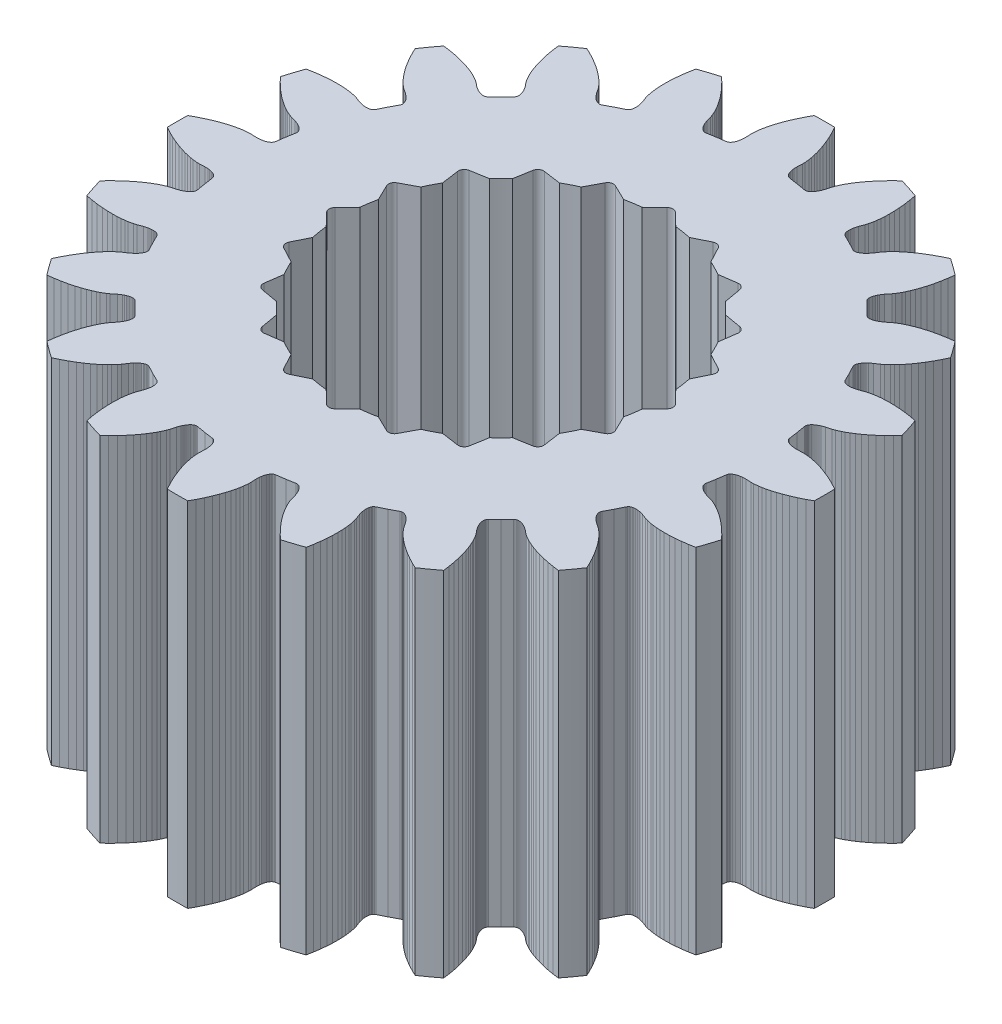
from build123d import *

# Parameters (mm, degrees)
SKETCH2_R           = 1
BOSS_EXTRUDE1_DEPTH = 6
CUT_EXTRUDE1_DEPTH  = 6


with BuildPart() as part:
    # Sketch2 → Boss-Extrude1 (new body)
    with BuildSketch(Plane(origin=(0, 0, 0), x_dir=(1, 0, 0), z_dir=(0, 1, 0))):
        with BuildLine():
            Line((0.437953894, 4.732665816), (0.430042291, 4.808517351))
            Line((0.430042291, 4.808517351), (0.421963885, 4.857362483))
            Line((0.421963885, 4.857362483), (0.41003729, 4.914704159))
            Line((0.41003729, 4.914704159), (0.393495471, 4.980238734))
            Line((0.393495471, 4.980238734), (0.372280186, 5.051616285))
            Line((0.372280186, 5.051616285), (0.344894894, 5.13134186))
            Line((0.344894894, 5.13134186), (0.311848301, 5.215851943))
            Line((0.311848301, 5.215851943), (0.271243793, 5.308129962))
            Line((0.271243793, 5.308129962), (0.223490897, 5.405326852))
            Line((0.223490897, 5.405326852), (0.17362484, 5.497251118))
            ThreePointArc((0.17362484, 5.497251118), (-1.14e-07, 5.499992315), (-0.173625068, 5.497251115))
            Line((-0.173625068, 5.497251115), (-0.223491109, 5.40532684))
            Line((-0.223491109, 5.40532684), (-0.271244004, 5.30812995))
            Line((-0.271244004, 5.30812995), (-0.311848512, 5.21585193))
            Line((-0.311848512, 5.21585193), (-0.344895106, 5.131341847))
            Line((-0.344895106, 5.131341847), (-0.372280397, 5.051616273))
            Line((-0.372280397, 5.051616273), (-0.393495683, 4.980238722))
            Line((-0.393495683, 4.980238722), (-0.410037502, 4.914704146))
            Line((-0.410037502, 4.914704146), (-0.421964096, 4.85736247))
            Line((-0.421964096, 4.85736247), (-0.430042502, 4.808517338))
            Line((-0.430042502, 4.808517338), (-0.437954105, 4.732665803))
            Line((-0.437954105, 4.732665803), (-0.438848904, 4.686153156))
            Line((-0.438848904, 4.686153156), (-0.434136903, 4.598359437))
            Line((-0.434136903, 4.598359437), (-0.437125701, 4.538474584))
            Line((-0.437125701, 4.538474584), (-0.440687596, 4.511677521))
            Line((-0.440687596, 4.511677521), (-0.445532499, 4.487036208))
            Line((-0.445532499, 4.487036208), (-0.451554927, 4.464587701))
            Line((-0.451554927, 4.464587701), (-0.458670633, 4.444375686))
            Line((-0.458670633, 4.444375686), (-0.466784119, 4.426435617))
            Line((-0.466784119, 4.426435617), (-0.475807889, 4.410791368))
            Line((-0.475807889, 4.410791368), (-0.48564799, 4.397488267))
            Line((-0.48564799, 4.397488267), (-0.496213866, 4.386530492))
            Line((-0.496213866, 4.386530492), (-0.507400065, 4.377954992))
            Line((-0.507400065, 4.377954992), (-0.519117739, 4.371775853))
            Line((-0.519117739, 4.371775853), (-0.537475389, 4.367055966))
            Line((-0.537475389, 4.367055966), (-0.688311733, 4.34582866))
            Line((-0.688311733, 4.34582866), (-0.838325226, 4.319406079))
            Line((-0.838325226, 4.319406079), (-0.857242917, 4.318222179))
            Line((-0.857242917, 4.318222179), (-0.870296551, 4.320477903))
            Line((-0.870296551, 4.320477903), (-0.883585254, 4.325176904))
            Line((-0.883585254, 4.325176904), (-0.897020134, 4.33233334))
            Line((-0.897020134, 4.33233334), (-0.910489504, 4.34194459))
            Line((-0.910489504, 4.34194459), (-0.923905962, 4.354034652))
            Line((-0.923905962, 4.354034652), (-0.937166102, 4.368589495))
            Line((-0.937166102, 4.368589495), (-0.95017946, 4.385613341))
            Line((-0.95017946, 4.385613341), (-0.962844102, 4.405102105))
            Line((-0.962844102, 4.405102105), (-0.975066503, 4.427040207))
            Line((-0.975066503, 4.427040207), (-0.986734698, 4.451425098))
            Line((-0.986734698, 4.451425098), (-1.008082602, 4.507455407))
            Line((-1.008082602, 4.507455407), (-1.030730994, 4.592408279))
            Line((-1.030730994, 4.592408279), (-1.045955299, 4.636367892))
            Line((-1.045955299, 4.636367892), (-1.07691909, 4.70606217))
            Line((-1.07691909, 4.70606217), (-1.099696095, 4.750020282))
            Line((-1.099696095, 4.750020282), (-1.12875848, 4.800869955))
            Line((-1.12875848, 4.800869955), (-1.164742018, 4.858085315))
            Line((-1.164742018, 4.858085315), (-1.206975822, 4.919413521))
            Line((-1.206975822, 4.919413521), (-1.257657395, 4.986774486))
            Line((-1.257657395, 4.986774486), (-1.31520161, 5.056936404))
            Line((-1.31520161, 5.056936404), (-1.382334201, 5.132150593))
            Line((-1.382334201, 5.132150593), (-1.457785437, 5.209833831))
            Line((-1.457785437, 5.209833831), (-1.533617059, 5.281849521))
            ThreePointArc((-1.533617059, 5.281849521), (-1.699591229, 5.230803506), (-1.863871246, 5.174543425))
            Line((-1.863871246, 5.174543425), (-1.882890455, 5.07170878))
            Line((-1.882890455, 5.07170878), (-1.898270752, 4.9645126))
            Line((-1.898270752, 4.9645126), (-1.908372352, 4.864203495))
            Line((-1.908372352, 4.864203495), (-1.913686454, 4.773617669))
            Line((-1.913686454, 4.773617669), (-1.915094954, 4.689331624))
            Line((-1.915094954, 4.689331624), (-1.913214955, 4.614891656))
            Line((-1.913214955, 4.614891656), (-1.908695856, 4.547452868))
            Line((-1.908695856, 4.547452868), (-1.902319157, 4.489232175))
            Line((-1.902319157, 4.489232175), (-1.894908249, 4.440281322))
            Line((-1.894908249, 4.440281322), (-1.878993244, 4.3656974))
            Line((-1.878993244, 4.3656974), (-1.865471055, 4.321184734))
            Line((-1.865471055, 4.321184734), (-1.833859951, 4.239144024))
            Line((-1.833859951, 4.239144024), (-1.818196964, 4.181266572))
            Line((-1.818196964, 4.181266572), (-1.813303763, 4.154680368))
            Line((-1.813303763, 4.154680368), (-1.810296958, 4.129747928))
            Line((-1.810296958, 4.129747928), (-1.809087656, 4.106537098))
            Line((-1.809087656, 4.106537098), (-1.809609255, 4.085115455))
            Line((-1.809609255, 4.085115455), (-1.811781858, 4.065546231))
            Line((-1.811781858, 4.065546231), (-1.815529649, 4.04787917))
            Line((-1.815529649, 4.04787917), (-1.820777268, 4.032186415))
            Line((-1.820777268, 4.032186415), (-1.827439869, 4.018499914))
            Line((-1.827439869, 4.018499914), (-1.835428652, 4.006887438))
            Line((-1.835428652, 4.006887438), (-1.844663343, 3.997389747))
            Line((-1.844663343, 3.997389747), (-1.860663971, 3.987228029))
            Line((-1.860663971, 3.987228029), (-1.997558247, 3.920428641))
            Line((-1.997558247, 3.920428641), (-2.13206453, 3.84894255))
            Line((-2.13206453, 3.84894255), (-2.149690451, 3.841970642))
            Line((-2.149690451, 3.841970642), (-2.162802262, 3.84008224))
            Line((-2.162802262, 3.84008224), (-2.176892641, 3.84044484))
            Line((-2.176892641, 3.84044484), (-2.191881443, 3.84309934))
            Line((-2.191881443, 3.84309934), (-2.207661612, 3.84807793))
            Line((-2.207661612, 3.84807793), (-2.224157456, 3.85543035))
            Line((-2.224157456, 3.85543035), (-2.241266294, 3.865175215))
            Line((-2.241266294, 3.865175215), (-2.258903356, 3.877344557))
            Line((-2.258903356, 3.877344557), (-2.276970538, 3.891965843))
            Line((-2.276970538, 3.891965843), (-2.295373933, 3.909053338))
            Line((-2.295373933, 3.909053338), (-2.314006432, 3.928639037))
            Line((-2.314006432, 3.928639037), (-2.351623838, 3.975330144))
            Line((-2.351623838, 3.975330144), (-2.399415607, 4.049126396))
            Line((-2.399415607, 4.049126396), (-2.427479025, 4.086229921))
            Line((-2.427479025, 4.086229921), (-2.478464069, 4.14294477))
            Line((-2.478464069, 4.14294477), (-2.513710064, 4.177712965))
            Line((-2.513710064, 4.177712965), (-2.557063476, 4.217093076))
            Line((-2.557063476, 4.217093076), (-2.608966333, 4.260388639))
            Line((-2.608966333, 4.260388639), (-2.668084542, 4.305664246))
            Line((-2.668084542, 4.305664246), (-2.737101265, 4.354066862))
            Line((-2.737101265, 4.354066862), (-2.813510242, 4.403012748))
            Line((-2.813510242, 4.403012748), (-2.90059962, 4.453800535))
            Line((-2.90059962, 4.453800535), (-2.996363458, 4.504365955))
            Line((-2.996363458, 4.504365955), (-3.090737653, 4.549423759))
            ThreePointArc((-3.090737653, 4.549423759), (-3.232814409, 4.44958726), (-3.371668693, 4.345315411))
            Line((-3.371668693, 4.345315411), (-3.357979391, 4.241636592))
            Line((-3.357979391, 4.241636592), (-3.339481491, 4.134934192))
            Line((-3.339481491, 4.134934192), (-3.318091491, 4.036412992))
            Line((-3.318091491, 4.036412992), (-3.295152991, 3.948618592))
            Line((-3.295152991, 3.948618592), (-3.270446591, 3.868022592))
            Line((-3.270446591, 3.868022592), (-3.245655491, 3.797806892))
            Line((-3.245655491, 3.797806892), (-3.220517791, 3.735065292))
            Line((-3.220517791, 3.735065292), (-3.196462091, 3.681664592))
            Line((-3.196462091, 3.681664592), (-3.174287191, 3.637399692))
            Line((-3.174287191, 3.637399692), (-3.136103391, 3.571384192))
            Line((-3.136103391, 3.571384192), (-3.109487891, 3.533228692))
            Line((-3.109487891, 3.533228692), (-3.054071991, 3.464971692))
            Line((-3.054071991, 3.464971692), (-3.021290491, 3.414767092))
            Line((-3.021290491, 3.414767092), (-3.008421191, 3.390994192))
            Line((-3.008421191, 3.390994192), (-2.997856991, 3.368211192))
            Line((-2.997856991, 3.368211192), (-2.989534291, 3.346510092))
            Line((-2.989534291, 3.346510092), (-2.983410791, 3.325975692))
            Line((-2.983410791, 3.325975692), (-2.979429791, 3.306692892))
            Line((-2.979429791, 3.306692892), (-2.977534691, 3.288732392))
            Line((-2.977534691, 3.288732392), (-2.977676191, 3.272186092))
            Line((-2.977676191, 3.272186092), (-2.979783291, 3.257110592))
            Line((-2.979783291, 3.257110592), (-2.983792591, 3.243597792))
            Line((-2.983792591, 3.243597792), (-2.989640391, 3.231711292))
            Line((-2.989640391, 3.231711292), (-3.001717791, 3.217102492))
            Line((-3.001717791, 3.217102492), (-3.111269791, 3.111269792))
            Line((-3.111269791, 3.111269792), (-3.217102491, 3.001717792))
            Line((-3.217102491, 3.001717792), (-3.231711291, 2.989640392))
            Line((-3.231711291, 2.989640392), (-3.243597791, 2.983792592))
            Line((-3.243597791, 2.983792592), (-3.257110591, 2.979783292))
            Line((-3.257110591, 2.979783292), (-3.272186091, 2.977676192))
            Line((-3.272186091, 2.977676192), (-3.288732391, 2.977534692))
            Line((-3.288732391, 2.977534692), (-3.306692891, 2.979429792))
            Line((-3.306692891, 2.979429792), (-3.325975691, 2.983410792))
            Line((-3.325975691, 2.983410792), (-3.346510091, 2.989534292))
            Line((-3.346510091, 2.989534292), (-3.368211191, 2.997856992))
            Line((-3.368211191, 2.997856992), (-3.390994191, 3.008421192))
            Line((-3.390994191, 3.008421192), (-3.414767091, 3.021290492))
            Line((-3.414767091, 3.021290492), (-3.464971691, 3.054071992))
            Line((-3.464971691, 3.054071992), (-3.533228691, 3.109487892))
            Line((-3.533228691, 3.109487892), (-3.571384191, 3.136103392))
            Line((-3.571384191, 3.136103392), (-3.637399691, 3.174287192))
            Line((-3.637399691, 3.174287192), (-3.681664591, 3.196462092))
            Line((-3.681664591, 3.196462092), (-3.735065291, 3.220517792))
            Line((-3.735065291, 3.220517792), (-3.797806891, 3.245655492))
            Line((-3.797806891, 3.245655492), (-3.868022591, 3.270446592))
            Line((-3.868022591, 3.270446592), (-3.948618591, 3.295152992))
            Line((-3.948618591, 3.295152992), (-4.036412991, 3.318091492))
            Line((-4.036412991, 3.318091492), (-4.134934191, 3.339481492))
            Line((-4.134934191, 3.339481492), (-4.241636591, 3.357979392))
            Line((-4.241636591, 3.357979392), (-4.345315408, 3.371668702))
            ThreePointArc((-4.345315408, 3.371668702), (-4.449587256, 3.232814421), (-4.549423754, 3.09073767))
            Line((-4.549423754, 3.09073767), (-4.504365973, 2.996363463))
            Line((-4.504365973, 2.996363463), (-4.453800553, 2.900599625))
            Line((-4.453800553, 2.900599625), (-4.403012766, 2.813510247))
            Line((-4.403012766, 2.813510247), (-4.354066881, 2.73710127))
            Line((-4.354066881, 2.73710127), (-4.305664264, 2.668084547))
            Line((-4.305664264, 2.668084547), (-4.260388658, 2.608966338))
            Line((-4.260388658, 2.608966338), (-4.217093094, 2.557063482))
            Line((-4.217093094, 2.557063482), (-4.177712983, 2.51371007))
            Line((-4.177712983, 2.51371007), (-4.142944788, 2.478464075))
            Line((-4.142944788, 2.478464075), (-4.086229939, 2.427479031))
            Line((-4.086229939, 2.427479031), (-4.049126414, 2.399415612))
            Line((-4.049126414, 2.399415612), (-3.975330162, 2.351623843))
            Line((-3.975330162, 2.351623843), (-3.928639056, 2.314006438))
            Line((-3.928639056, 2.314006438), (-3.909053356, 2.295373938))
            Line((-3.909053356, 2.295373938), (-3.891965861, 2.276970544))
            Line((-3.891965861, 2.276970544), (-3.877344576, 2.258903361))
            Line((-3.877344576, 2.258903361), (-3.865175233, 2.2412663))
            Line((-3.865175233, 2.2412663), (-3.855430368, 2.224157461))
            Line((-3.855430368, 2.224157461), (-3.848077948, 2.207661617))
            Line((-3.848077948, 2.207661617), (-3.843099358, 2.191881449))
            Line((-3.843099358, 2.191881449), (-3.840444858, 2.176892646))
            Line((-3.840444858, 2.176892646), (-3.840082259, 2.162802268))
            Line((-3.840082259, 2.162802268), (-3.84197066, 2.149690457))
            Line((-3.84197066, 2.149690457), (-3.848942569, 2.132064535))
            Line((-3.848942569, 2.132064535), (-3.920428659, 1.997558253))
            Line((-3.920428659, 1.997558253), (-3.987228048, 1.860663977))
            Line((-3.987228048, 1.860663977), (-3.997389766, 1.844663348))
            Line((-3.997389766, 1.844663348), (-4.006887456, 1.835428657))
            Line((-4.006887456, 1.835428657), (-4.018499932, 1.827439874))
            Line((-4.018499932, 1.827439874), (-4.032186434, 1.820777273))
            Line((-4.032186434, 1.820777273), (-4.047879189, 1.815529655))
            Line((-4.047879189, 1.815529655), (-4.065546249, 1.811781863))
            Line((-4.065546249, 1.811781863), (-4.085115473, 1.80960926))
            Line((-4.085115473, 1.80960926), (-4.106537116, 1.809087662))
            Line((-4.106537116, 1.809087662), (-4.129747947, 1.810296963))
            Line((-4.129747947, 1.810296963), (-4.154680386, 1.813303768))
            Line((-4.154680386, 1.813303768), (-4.18126659, 1.818196969))
            Line((-4.18126659, 1.818196969), (-4.239144042, 1.833859956))
            Line((-4.239144042, 1.833859956), (-4.321184752, 1.86547106))
            Line((-4.321184752, 1.86547106), (-4.365697418, 1.878993249))
            Line((-4.365697418, 1.878993249), (-4.44028134, 1.894908254))
            Line((-4.44028134, 1.894908254), (-4.489232193, 1.902319162))
            Line((-4.489232193, 1.902319162), (-4.547452887, 1.908695861))
            Line((-4.547452887, 1.908695861), (-4.614891674, 1.913214961))
            Line((-4.614891674, 1.913214961), (-4.689331642, 1.91509496))
            Line((-4.689331642, 1.91509496), (-4.773617688, 1.913686459))
            Line((-4.773617688, 1.913686459), (-4.864203513, 1.908372358))
            Line((-4.864203513, 1.908372358), (-4.964512619, 1.898270757))
            Line((-4.964512619, 1.898270757), (-5.071708798, 1.88289046))
            Line((-5.071708798, 1.88289046), (-5.17454344, 1.863871236))
            ThreePointArc((-5.17454344, 1.863871236), (-5.230803538, 1.699591168), (-5.281849567, 1.533616947))
            Line((-5.281849567, 1.533616947), (-5.209833861, 1.45778534))
            Line((-5.209833861, 1.45778534), (-5.132150623, 1.382334104))
            Line((-5.132150623, 1.382334104), (-5.056936434, 1.315201514))
            Line((-5.056936434, 1.315201514), (-4.986774516, 1.257657299))
            Line((-4.986774516, 1.257657299), (-4.919413551, 1.206975725))
            Line((-4.919413551, 1.206975725), (-4.858085345, 1.164741921))
            Line((-4.858085345, 1.164741921), (-4.800869985, 1.128758383))
            Line((-4.800869985, 1.128758383), (-4.750020312, 1.099695999))
            Line((-4.750020312, 1.099695999), (-4.7060622, 1.076918993))
            Line((-4.7060622, 1.076918993), (-4.636367922, 1.045955202))
            Line((-4.636367922, 1.045955202), (-4.592408309, 1.030730898))
            Line((-4.592408309, 1.030730898), (-4.507455437, 1.008082505))
            Line((-4.507455437, 1.008082505), (-4.451425128, 0.986734602))
            Line((-4.451425128, 0.986734602), (-4.427040237, 0.975066406))
            Line((-4.427040237, 0.975066406), (-4.405102135, 0.962844005))
            Line((-4.405102135, 0.962844005), (-4.385613371, 0.950179363))
            Line((-4.385613371, 0.950179363), (-4.368589525, 0.937166005))
            Line((-4.368589525, 0.937166005), (-4.354034682, 0.923905866))
            Line((-4.354034682, 0.923905866), (-4.34194462, 0.910489407))
            Line((-4.34194462, 0.910489407), (-4.33233337, 0.897020037))
            Line((-4.33233337, 0.897020037), (-4.325176934, 0.883585157))
            Line((-4.325176934, 0.883585157), (-4.320477933, 0.870296454))
            Line((-4.320477933, 0.870296454), (-4.318222209, 0.85724282))
            Line((-4.318222209, 0.85724282), (-4.319406109, 0.838325129))
            Line((-4.319406109, 0.838325129), (-4.34582869, 0.688311636))
            Line((-4.34582869, 0.688311636), (-4.367055996, 0.537475292))
            Line((-4.367055996, 0.537475292), (-4.371775883, 0.519117643))
            Line((-4.371775883, 0.519117643), (-4.377955022, 0.507399968))
            Line((-4.377955022, 0.507399968), (-4.386530522, 0.496213769))
            Line((-4.386530522, 0.496213769), (-4.397488297, 0.485647893))
            Line((-4.397488297, 0.485647893), (-4.410791398, 0.475807793))
            Line((-4.410791398, 0.475807793), (-4.426435647, 0.466784022))
            Line((-4.426435647, 0.466784022), (-4.444375716, 0.458670536))
            Line((-4.444375716, 0.458670536), (-4.464587731, 0.45155483))
            Line((-4.464587731, 0.45155483), (-4.487036238, 0.445532402))
            Line((-4.487036238, 0.445532402), (-4.511677551, 0.440687499))
            Line((-4.511677551, 0.440687499), (-4.538474614, 0.437125604))
            Line((-4.538474614, 0.437125604), (-4.598359467, 0.434136807))
            Line((-4.598359467, 0.434136807), (-4.686153186, 0.438848808))
            Line((-4.686153186, 0.438848808), (-4.732665833, 0.437954009))
            Line((-4.732665833, 0.437954009), (-4.808517368, 0.430042405))
            Line((-4.808517368, 0.430042405), (-4.8573625, 0.421964))
            Line((-4.8573625, 0.421964), (-4.914704176, 0.410037405))
            Line((-4.914704176, 0.410037405), (-4.980238751, 0.393495586))
            Line((-4.980238751, 0.393495586), (-5.051616303, 0.3722803))
            Line((-5.051616303, 0.3722803), (-5.131341877, 0.344895009))
            Line((-5.131341877, 0.344895009), (-5.21585196, 0.311848416))
            Line((-5.21585196, 0.311848416), (-5.30812998, 0.271243907))
            Line((-5.30812998, 0.271243907), (-5.40532687, 0.223491012))
            Line((-5.40532687, 0.223491012), (-5.497251137, 0.173624956))
            ThreePointArc((-5.497251137, 0.173624956), (-5.499992334, 1e-09), (-5.497251134, -0.173624953))
            Line((-5.497251134, -0.173624953), (-5.405326859, -0.223490994))
            Line((-5.405326859, -0.223490994), (-5.308129968, -0.271243889))
            Line((-5.308129968, -0.271243889), (-5.215851949, -0.311848398))
            Line((-5.215851949, -0.311848398), (-5.131341866, -0.344894991))
            Line((-5.131341866, -0.344894991), (-5.051616292, -0.372280282))
            Line((-5.051616292, -0.372280282), (-4.98023874, -0.393495568))
            Line((-4.98023874, -0.393495568), (-4.914704165, -0.410037387))
            Line((-4.914704165, -0.410037387), (-4.857362489, -0.421963982))
            Line((-4.857362489, -0.421963982), (-4.808517357, -0.430042387))
            Line((-4.808517357, -0.430042387), (-4.732665822, -0.437953991))
            Line((-4.732665822, -0.437953991), (-4.686153175, -0.43884879))
            Line((-4.686153175, -0.43884879), (-4.598359456, -0.434136789))
            Line((-4.598359456, -0.434136789), (-4.538474602, -0.437125586))
            Line((-4.538474602, -0.437125586), (-4.51167754, -0.440687481))
            Line((-4.51167754, -0.440687481), (-4.487036226, -0.445532384))
            Line((-4.487036226, -0.445532384), (-4.46458772, -0.451554812))
            Line((-4.46458772, -0.451554812), (-4.444375705, -0.458670518))
            Line((-4.444375705, -0.458670518), (-4.426435636, -0.466784004))
            Line((-4.426435636, -0.466784004), (-4.410791387, -0.475807775))
            Line((-4.410791387, -0.475807775), (-4.397488286, -0.485647875))
            Line((-4.397488286, -0.485647875), (-4.386530511, -0.496213751))
            Line((-4.386530511, -0.496213751), (-4.377955011, -0.507399951))
            Line((-4.377955011, -0.507399951), (-4.371775872, -0.519117625))
            Line((-4.371775872, -0.519117625), (-4.367055985, -0.537475274))
            Line((-4.367055985, -0.537475274), (-4.345828679, -0.688311618))
            Line((-4.345828679, -0.688311618), (-4.319406098, -0.838325112))
            Line((-4.319406098, -0.838325112), (-4.318222198, -0.857242802))
            Line((-4.318222198, -0.857242802), (-4.320477921, -0.870296436))
            Line((-4.320477921, -0.870296436), (-4.325176923, -0.883585139))
            Line((-4.325176923, -0.883585139), (-4.332333359, -0.897020019))
            Line((-4.332333359, -0.897020019), (-4.341944609, -0.910489389))
            Line((-4.341944609, -0.910489389), (-4.354034671, -0.923905848))
            Line((-4.354034671, -0.923905848), (-4.368589514, -0.937165987))
            Line((-4.368589514, -0.937165987), (-4.38561336, -0.950179345))
            Line((-4.38561336, -0.950179345), (-4.405102124, -0.962843987))
            Line((-4.405102124, -0.962843987), (-4.427040226, -0.975066388))
            Line((-4.427040226, -0.975066388), (-4.451425116, -0.986734584))
            Line((-4.451425116, -0.986734584), (-4.507455426, -1.008082487))
            Line((-4.507455426, -1.008082487), (-4.592408297, -1.03073088))
            Line((-4.592408297, -1.03073088), (-4.63636791, -1.045955184))
            Line((-4.63636791, -1.045955184), (-4.706062189, -1.076918975))
            Line((-4.706062189, -1.076918975), (-4.750020301, -1.099695981))
            Line((-4.750020301, -1.099695981), (-4.800869974, -1.128758365))
            Line((-4.800869974, -1.128758365), (-4.858085333, -1.164741903))
            Line((-4.858085333, -1.164741903), (-4.91941354, -1.206975707))
            Line((-4.91941354, -1.206975707), (-4.986774504, -1.257657281))
            Line((-4.986774504, -1.257657281), (-5.056936423, -1.315201496))
            Line((-5.056936423, -1.315201496), (-5.132150612, -1.382334086))
            Line((-5.132150612, -1.382334086), (-5.209833849, -1.457785322))
            Line((-5.209833849, -1.457785322), (-5.281849541, -1.533616942))
            ThreePointArc((-5.281849541, -1.533616942), (-5.230803524, -1.69959112), (-5.17454344, -1.863871145))
            Line((-5.17454344, -1.863871145), (-5.071708795, -1.882890353))
            Line((-5.071708795, -1.882890353), (-4.964512616, -1.89827065))
            Line((-4.964512616, -1.89827065), (-4.86420351, -1.908372251))
            Line((-4.86420351, -1.908372251), (-4.773617685, -1.913686352))
            Line((-4.773617685, -1.913686352), (-4.689331639, -1.915094853))
            Line((-4.689331639, -1.915094853), (-4.614891671, -1.913214854))
            Line((-4.614891671, -1.913214854), (-4.547452884, -1.908695755))
            Line((-4.547452884, -1.908695755), (-4.48923219, -1.902319056))
            Line((-4.48923219, -1.902319056), (-4.440281337, -1.894908148))
            Line((-4.440281337, -1.894908148), (-4.365697415, -1.878993143))
            Line((-4.365697415, -1.878993143), (-4.321184749, -1.865470953))
            Line((-4.321184749, -1.865470953), (-4.239144039, -1.833859849))
            Line((-4.239144039, -1.833859849), (-4.181266587, -1.818196862))
            Line((-4.181266587, -1.818196862), (-4.154680383, -1.813303662))
            Line((-4.154680383, -1.813303662), (-4.129747944, -1.810296857))
            Line((-4.129747944, -1.810296857), (-4.106537113, -1.809087555))
            Line((-4.106537113, -1.809087555), (-4.08511547, -1.809609154))
            Line((-4.08511547, -1.809609154), (-4.065546246, -1.811781757))
            Line((-4.065546246, -1.811781757), (-4.047879186, -1.815529548))
            Line((-4.047879186, -1.815529548), (-4.03218643, -1.820777167))
            Line((-4.03218643, -1.820777167), (-4.018499929, -1.827439767))
            Line((-4.018499929, -1.827439767), (-4.006887453, -1.835428551))
            Line((-4.006887453, -1.835428551), (-3.997389763, -1.844663242))
            Line((-3.997389763, -1.844663242), (-3.987228044, -1.86066387))
            Line((-3.987228044, -1.86066387), (-3.920428656, -1.997558146))
            Line((-3.920428656, -1.997558146), (-3.848942566, -2.132064428))
            Line((-3.848942566, -2.132064428), (-3.841970657, -2.14969035))
            Line((-3.841970657, -2.14969035), (-3.840082255, -2.162802161))
            Line((-3.840082255, -2.162802161), (-3.840444855, -2.17689254))
            Line((-3.840444855, -2.17689254), (-3.843099355, -2.191881342))
            Line((-3.843099355, -2.191881342), (-3.848077945, -2.20766151))
            Line((-3.848077945, -2.20766151), (-3.855430365, -2.224157355))
            Line((-3.855430365, -2.224157355), (-3.86517523, -2.241266193))
            Line((-3.86517523, -2.241266193), (-3.877344572, -2.258903255))
            Line((-3.877344572, -2.258903255), (-3.891965858, -2.276970437))
            Line((-3.891965858, -2.276970437), (-3.909053353, -2.295373832))
            Line((-3.909053353, -2.295373832), (-3.928639052, -2.314006331))
            Line((-3.928639052, -2.314006331), (-3.975330159, -2.351623736))
            Line((-3.975330159, -2.351623736), (-4.049126411, -2.399415505))
            Line((-4.049126411, -2.399415505), (-4.086229936, -2.427478924))
            Line((-4.086229936, -2.427478924), (-4.142944785, -2.478463968))
            Line((-4.142944785, -2.478463968), (-4.17771298, -2.513709963))
            Line((-4.17771298, -2.513709963), (-4.217093091, -2.557063375))
            Line((-4.217093091, -2.557063375), (-4.260388655, -2.608966232))
            Line((-4.260388655, -2.608966232), (-4.305664261, -2.66808444))
            Line((-4.305664261, -2.66808444), (-4.354066878, -2.737101164))
            Line((-4.354066878, -2.737101164), (-4.403012763, -2.813510141))
            Line((-4.403012763, -2.813510141), (-4.45380055, -2.900599518))
            Line((-4.45380055, -2.900599518), (-4.50436597, -2.996363357))
            Line((-4.50436597, -2.996363357), (-4.54942377, -3.090737554))
            ThreePointArc((-4.54942377, -3.090737554), (-4.449587271, -3.232814309), (-4.345315422, -3.371668592))
            Line((-4.345315422, -3.371668592), (-4.241636604, -3.357979285))
            Line((-4.241636604, -3.357979285), (-4.134934204, -3.339481385))
            Line((-4.134934204, -3.339481385), (-4.036413004, -3.318091385))
            Line((-4.036413004, -3.318091385), (-3.948618604, -3.295152885))
            Line((-3.948618604, -3.295152885), (-3.868022604, -3.270446485))
            Line((-3.868022604, -3.270446485), (-3.797806904, -3.245655385))
            Line((-3.797806904, -3.245655385), (-3.735065304, -3.220517685))
            Line((-3.735065304, -3.220517685), (-3.681664604, -3.196461985))
            Line((-3.681664604, -3.196461985), (-3.637399704, -3.174287085))
            Line((-3.637399704, -3.174287085), (-3.571384204, -3.136103285))
            Line((-3.571384204, -3.136103285), (-3.533228704, -3.109487785))
            Line((-3.533228704, -3.109487785), (-3.464971704, -3.054071885))
            Line((-3.464971704, -3.054071885), (-3.414767104, -3.021290385))
            Line((-3.414767104, -3.021290385), (-3.390994204, -3.008421085))
            Line((-3.390994204, -3.008421085), (-3.368211204, -2.997856885))
            Line((-3.368211204, -2.997856885), (-3.346510104, -2.989534185))
            Line((-3.346510104, -2.989534185), (-3.325975704, -2.983410685))
            Line((-3.325975704, -2.983410685), (-3.306692904, -2.979429685))
            Line((-3.306692904, -2.979429685), (-3.288732404, -2.977534585))
            Line((-3.288732404, -2.977534585), (-3.272186104, -2.977676085))
            Line((-3.272186104, -2.977676085), (-3.257110604, -2.979783185))
            Line((-3.257110604, -2.979783185), (-3.243597804, -2.983792485))
            Line((-3.243597804, -2.983792485), (-3.231711304, -2.989640285))
            Line((-3.231711304, -2.989640285), (-3.217102504, -3.001717685))
            Line((-3.217102504, -3.001717685), (-3.111269804, -3.111269685))
            Line((-3.111269804, -3.111269685), (-3.001717804, -3.217102385))
            Line((-3.001717804, -3.217102385), (-2.989640404, -3.231711185))
            Line((-2.989640404, -3.231711185), (-2.983792604, -3.243597685))
            Line((-2.983792604, -3.243597685), (-2.979783304, -3.257110485))
            Line((-2.979783304, -3.257110485), (-2.977676204, -3.272185985))
            Line((-2.977676204, -3.272185985), (-2.977534704, -3.288732285))
            Line((-2.977534704, -3.288732285), (-2.979429804, -3.306692785))
            Line((-2.979429804, -3.306692785), (-2.983410804, -3.325975585))
            Line((-2.983410804, -3.325975585), (-2.989534304, -3.346509985))
            Line((-2.989534304, -3.346509985), (-2.997857004, -3.368211085))
            Line((-2.997857004, -3.368211085), (-3.008421204, -3.390994085))
            Line((-3.008421204, -3.390994085), (-3.021290504, -3.414766985))
            Line((-3.021290504, -3.414766985), (-3.054072004, -3.464971585))
            Line((-3.054072004, -3.464971585), (-3.109487904, -3.533228585))
            Line((-3.109487904, -3.533228585), (-3.136103404, -3.571384085))
            Line((-3.136103404, -3.571384085), (-3.174287204, -3.637399585))
            Line((-3.174287204, -3.637399585), (-3.196462104, -3.681664485))
            Line((-3.196462104, -3.681664485), (-3.220517804, -3.735065185))
            Line((-3.220517804, -3.735065185), (-3.245655504, -3.797806785))
            Line((-3.245655504, -3.797806785), (-3.270446604, -3.868022485))
            Line((-3.270446604, -3.868022485), (-3.295153004, -3.948618485))
            Line((-3.295153004, -3.948618485), (-3.318091504, -4.036412885))
            Line((-3.318091504, -4.036412885), (-3.339481504, -4.134934085))
            Line((-3.339481504, -4.134934085), (-3.357979404, -4.241636485))
            Line((-3.357979404, -4.241636485), (-3.371668713, -4.345315303))
            ThreePointArc((-3.371668713, -4.345315303), (-3.232814435, -4.449587149), (-3.090737686, -4.549423645))
            Line((-3.090737686, -4.549423645), (-2.996363479, -4.504365863))
            Line((-2.996363479, -4.504365863), (-2.900599641, -4.453800443))
            Line((-2.900599641, -4.453800443), (-2.813510264, -4.403012656))
            Line((-2.813510264, -4.403012656), (-2.737101287, -4.354066771))
            Line((-2.737101287, -4.354066771), (-2.668084563, -4.305664155))
            Line((-2.668084563, -4.305664155), (-2.608966354, -4.260388548))
            Line((-2.608966354, -4.260388548), (-2.557063498, -4.217092984))
            Line((-2.557063498, -4.217092984), (-2.513710086, -4.177712873))
            Line((-2.513710086, -4.177712873), (-2.478464091, -4.142944678))
            Line((-2.478464091, -4.142944678), (-2.427479047, -4.086229829))
            Line((-2.427479047, -4.086229829), (-2.399415628, -4.049126304))
            Line((-2.399415628, -4.049126304), (-2.351623859, -3.975330052))
            Line((-2.351623859, -3.975330052), (-2.314006454, -3.928638946))
            Line((-2.314006454, -3.928638946), (-2.295373954, -3.909053246))
            Line((-2.295373954, -3.909053246), (-2.27697056, -3.891965751))
            Line((-2.27697056, -3.891965751), (-2.258903377, -3.877344466))
            Line((-2.258903377, -3.877344466), (-2.241266316, -3.865175123))
            Line((-2.241266316, -3.865175123), (-2.224157478, -3.855430258))
            Line((-2.224157478, -3.855430258), (-2.207661633, -3.848077839))
            Line((-2.207661633, -3.848077839), (-2.191881465, -3.843099249))
            Line((-2.191881465, -3.843099249), (-2.176892662, -3.840444748))
            Line((-2.176892662, -3.840444748), (-2.162802284, -3.840082149))
            Line((-2.162802284, -3.840082149), (-2.149690473, -3.84197055))
            Line((-2.149690473, -3.84197055), (-2.132064551, -3.848942459))
            Line((-2.132064551, -3.848942459), (-1.997558269, -3.920428549))
            Line((-1.997558269, -3.920428549), (-1.860663993, -3.987227938))
            Line((-1.860663993, -3.987227938), (-1.844663364, -3.997389656))
            Line((-1.844663364, -3.997389656), (-1.835428673, -4.006887347))
            Line((-1.835428673, -4.006887347), (-1.82743989, -4.018499822))
            Line((-1.82743989, -4.018499822), (-1.820777289, -4.032186324))
            Line((-1.820777289, -4.032186324), (-1.815529671, -4.047879079))
            Line((-1.815529671, -4.047879079), (-1.811781879, -4.065546139))
            Line((-1.811781879, -4.065546139), (-1.809609277, -4.085115363))
            Line((-1.809609277, -4.085115363), (-1.809087678, -4.106537006))
            Line((-1.809087678, -4.106537006), (-1.81029698, -4.129747837))
            Line((-1.81029698, -4.129747837), (-1.813303784, -4.154680276))
            Line((-1.813303784, -4.154680276), (-1.818196985, -4.18126648))
            Line((-1.818196985, -4.18126648), (-1.833859972, -4.239143932))
            Line((-1.833859972, -4.239143932), (-1.865471076, -4.321184642))
            Line((-1.865471076, -4.321184642), (-1.878993266, -4.365697308))
            Line((-1.878993266, -4.365697308), (-1.89490827, -4.44028123))
            Line((-1.89490827, -4.44028123), (-1.902319178, -4.489232083))
            Line((-1.902319178, -4.489232083), (-1.908695878, -4.547452777))
            Line((-1.908695878, -4.547452777), (-1.913214977, -4.614891565))
            Line((-1.913214977, -4.614891565), (-1.915094976, -4.689331532))
            Line((-1.915094976, -4.689331532), (-1.913686475, -4.773617578))
            Line((-1.913686475, -4.773617578), (-1.908372374, -4.864203404))
            Line((-1.908372374, -4.864203404), (-1.898270773, -4.964512509))
            Line((-1.898270773, -4.964512509), (-1.882890476, -5.071708689))
            Line((-1.882890476, -5.071708689), (-1.863871252, -5.174543331))
            ThreePointArc((-1.863871252, -5.174543331), (-1.699591186, -5.230803428), (-1.533616965, -5.281849456))
            Line((-1.533616965, -5.281849456), (-1.457785359, -5.20983375))
            Line((-1.457785359, -5.20983375), (-1.382334122, -5.132150512))
            Line((-1.382334122, -5.132150512), (-1.315201532, -5.056936323))
            Line((-1.315201532, -5.056936323), (-1.257657317, -4.986774405))
            Line((-1.257657317, -4.986774405), (-1.206975744, -4.91941344))
            Line((-1.206975744, -4.91941344), (-1.164741939, -4.858085234))
            Line((-1.164741939, -4.858085234), (-1.128758402, -4.800869874))
            Line((-1.128758402, -4.800869874), (-1.099696017, -4.750020201))
            Line((-1.099696017, -4.750020201), (-1.076919011, -4.70606209))
            Line((-1.076919011, -4.70606209), (-1.045955221, -4.636367811))
            Line((-1.045955221, -4.636367811), (-1.030730916, -4.592408198))
            Line((-1.030730916, -4.592408198), (-1.008082524, -4.507455327))
            Line((-1.008082524, -4.507455327), (-0.98673462, -4.451425017))
            Line((-0.98673462, -4.451425017), (-0.975066425, -4.427040127))
            Line((-0.975066425, -4.427040127), (-0.962844024, -4.405102024))
            Line((-0.962844024, -4.405102024), (-0.950179382, -4.38561326))
            Line((-0.950179382, -4.38561326), (-0.937166023, -4.368589414))
            Line((-0.937166023, -4.368589414), (-0.923905884, -4.354034572))
            Line((-0.923905884, -4.354034572), (-0.910489426, -4.341944509))
            Line((-0.910489426, -4.341944509), (-0.897020056, -4.332333259))
            Line((-0.897020056, -4.332333259), (-0.883585176, -4.325176823))
            Line((-0.883585176, -4.325176823), (-0.870296472, -4.320477822))
            Line((-0.870296472, -4.320477822), (-0.857242838, -4.318222099))
            Line((-0.857242838, -4.318222099), (-0.838325148, -4.319405998))
            Line((-0.838325148, -4.319405998), (-0.688311654, -4.345828579))
            Line((-0.688311654, -4.345828579), (-0.537475311, -4.367055885))
            Line((-0.537475311, -4.367055885), (-0.519117661, -4.371775772))
            Line((-0.519117661, -4.371775772), (-0.507399987, -4.377954912))
            Line((-0.507399987, -4.377954912), (-0.496213788, -4.386530411))
            Line((-0.496213788, -4.386530411), (-0.485647912, -4.397488186))
            Line((-0.485647912, -4.397488186), (-0.475807811, -4.410791287))
            Line((-0.475807811, -4.410791287), (-0.46678404, -4.426435536))
            Line((-0.46678404, -4.426435536), (-0.458670554, -4.444375605))
            Line((-0.458670554, -4.444375605), (-0.451554849, -4.464587621))
            Line((-0.451554849, -4.464587621), (-0.44553242, -4.487036127))
            Line((-0.44553242, -4.487036127), (-0.440687518, -4.51167744))
            Line((-0.440687518, -4.51167744), (-0.437125623, -4.538474503))
            Line((-0.437125623, -4.538474503), (-0.434136825, -4.598359356))
            Line((-0.434136825, -4.598359356), (-0.438848826, -4.686153075))
            Line((-0.438848826, -4.686153075), (-0.437954027, -4.732665723))
            Line((-0.437954027, -4.732665723), (-0.430042423, -4.808517257))
            Line((-0.430042423, -4.808517257), (-0.421964018, -4.85736239))
            Line((-0.421964018, -4.85736239), (-0.410037423, -4.914704065))
            Line((-0.410037423, -4.914704065), (-0.393495604, -4.980238641))
            Line((-0.393495604, -4.980238641), (-0.372280319, -5.051616192))
            Line((-0.372280319, -5.051616192), (-0.344895027, -5.131341767))
            Line((-0.344895027, -5.131341767), (-0.311848434, -5.21585185))
            Line((-0.311848434, -5.21585185), (-0.271243926, -5.308129869))
            Line((-0.271243926, -5.308129869), (-0.22349103, -5.405326759))
            Line((-0.22349103, -5.405326759), (-0.173624974, -5.497251026))
            ThreePointArc((-0.173624974, -5.497251026), (-2e-08, -5.499992223), (0.173624934, -5.497251023))
            Line((0.173624934, -5.497251023), (0.223490975, -5.405326748))
            Line((0.223490975, -5.405326748), (0.27124387, -5.308129858))
            Line((0.27124387, -5.308129858), (0.311848379, -5.215851838))
            Line((0.311848379, -5.215851838), (0.344894972, -5.131341755))
            Line((0.344894972, -5.131341755), (0.372280264, -5.051616181))
            Line((0.372280264, -5.051616181), (0.393495549, -4.98023863))
            Line((0.393495549, -4.98023863), (0.410037368, -4.914704054))
            Line((0.410037368, -4.914704054), (0.421963963, -4.857362378))
            Line((0.421963963, -4.857362378), (0.430042368, -4.808517246))
            Line((0.430042368, -4.808517246), (0.437953972, -4.732665711))
            Line((0.437953972, -4.732665711), (0.438848771, -4.686153064))
            Line((0.438848771, -4.686153064), (0.43413677, -4.598359345))
            Line((0.43413677, -4.598359345), (0.437125568, -4.538474492))
            Line((0.437125568, -4.538474492), (0.440687463, -4.511677429))
            Line((0.440687463, -4.511677429), (0.445532365, -4.487036116))
            Line((0.445532365, -4.487036116), (0.451554794, -4.464587609))
            Line((0.451554794, -4.464587609), (0.458670499, -4.444375594))
            Line((0.458670499, -4.444375594), (0.466783985, -4.426435525))
            Line((0.466783985, -4.426435525), (0.475807756, -4.410791276))
            Line((0.475807756, -4.410791276), (0.485647856, -4.397488175))
            Line((0.485647856, -4.397488175), (0.496213732, -4.3865304))
            Line((0.496213732, -4.3865304), (0.507399932, -4.3779549))
            Line((0.507399932, -4.3779549), (0.519117606, -4.371775761))
            Line((0.519117606, -4.371775761), (0.537475255, -4.367055874))
            Line((0.537475255, -4.367055874), (0.688311599, -4.345828568))
            Line((0.688311599, -4.345828568), (0.838325093, -4.319405987))
            Line((0.838325093, -4.319405987), (0.857242783, -4.318222087))
            Line((0.857242783, -4.318222087), (0.870296417, -4.320477811))
            Line((0.870296417, -4.320477811), (0.883585121, -4.325176812))
            Line((0.883585121, -4.325176812), (0.89702, -4.332333248))
            Line((0.89702, -4.332333248), (0.910489371, -4.341944498))
            Line((0.910489371, -4.341944498), (0.923905829, -4.35403456))
            Line((0.923905829, -4.35403456), (0.937165968, -4.368589403))
            Line((0.937165968, -4.368589403), (0.950179327, -4.385613249))
            Line((0.950179327, -4.385613249), (0.962843968, -4.405102013))
            Line((0.962843968, -4.405102013), (0.97506637, -4.427040115))
            Line((0.97506637, -4.427040115), (0.986734565, -4.451425006))
            Line((0.986734565, -4.451425006), (1.008082469, -4.507455315))
            Line((1.008082469, -4.507455315), (1.030730861, -4.592408187))
            Line((1.030730861, -4.592408187), (1.045955165, -4.6363678))
            Line((1.045955165, -4.6363678), (1.076918956, -4.706062078))
            Line((1.076918956, -4.706062078), (1.099695962, -4.75002019))
            Line((1.099695962, -4.75002019), (1.128758347, -4.800869863))
            Line((1.128758347, -4.800869863), (1.164741884, -4.858085223))
            Line((1.164741884, -4.858085223), (1.206975689, -4.919413429))
            Line((1.206975689, -4.919413429), (1.257657262, -4.986774394))
            Line((1.257657262, -4.986774394), (1.315201477, -5.056936312))
            Line((1.315201477, -5.056936312), (1.382334067, -5.132150501))
            Line((1.382334067, -5.132150501), (1.457785304, -5.209833739))
            Line((1.457785304, -5.209833739), (1.533616924, -5.28184943))
            ThreePointArc((1.533616924, -5.28184943), (1.699591102, -5.230803413), (1.863871126, -5.174543329))
            Line((1.863871126, -5.174543329), (1.882890335, -5.071708684))
            Line((1.882890335, -5.071708684), (1.898270632, -4.964512505))
            Line((1.898270632, -4.964512505), (1.908372232, -4.864203399))
            Line((1.908372232, -4.864203399), (1.913686334, -4.773617574))
            Line((1.913686334, -4.773617574), (1.915094835, -4.689331528))
            Line((1.915094835, -4.689331528), (1.913214835, -4.61489156))
            Line((1.913214835, -4.61489156), (1.908695736, -4.547452773))
            Line((1.908695736, -4.547452773), (1.902319037, -4.489232079))
            Line((1.902319037, -4.489232079), (1.894908129, -4.440281226))
            Line((1.894908129, -4.440281226), (1.878993124, -4.365697304))
            Line((1.878993124, -4.365697304), (1.865470935, -4.321184638))
            Line((1.865470935, -4.321184638), (1.833859831, -4.239143928))
            Line((1.833859831, -4.239143928), (1.818196844, -4.181266476))
            Line((1.818196844, -4.181266476), (1.813303643, -4.154680272))
            Line((1.813303643, -4.154680272), (1.810296838, -4.129747833))
            Line((1.810296838, -4.129747833), (1.809087537, -4.106537002))
            Line((1.809087537, -4.106537002), (1.809609135, -4.085115359))
            Line((1.809609135, -4.085115359), (1.811781738, -4.065546135))
            Line((1.811781738, -4.065546135), (1.815529529, -4.047879075))
            Line((1.815529529, -4.047879075), (1.820777148, -4.03218632))
            Line((1.820777148, -4.03218632), (1.827439749, -4.018499818))
            Line((1.827439749, -4.018499818), (1.835428532, -4.006887342))
            Line((1.835428532, -4.006887342), (1.844663223, -3.997389652))
            Line((1.844663223, -3.997389652), (1.860663851, -3.987227934))
            Line((1.860663851, -3.987227934), (1.997558127, -3.920428545))
            Line((1.997558127, -3.920428545), (2.13206441, -3.848942455))
            Line((2.13206441, -3.848942455), (2.149690331, -3.841970546))
            Line((2.149690331, -3.841970546), (2.162802142, -3.840082145))
            Line((2.162802142, -3.840082145), (2.176892521, -3.840444744))
            Line((2.176892521, -3.840444744), (2.191881324, -3.843099244))
            Line((2.191881324, -3.843099244), (2.207661492, -3.848077834))
            Line((2.207661492, -3.848077834), (2.224157336, -3.855430254))
            Line((2.224157336, -3.855430254), (2.241266174, -3.865175119))
            Line((2.241266174, -3.865175119), (2.258903236, -3.877344462))
            Line((2.258903236, -3.877344462), (2.276970418, -3.891965747))
            Line((2.276970418, -3.891965747), (2.295373813, -3.909053242))
            Line((2.295373813, -3.909053242), (2.314006312, -3.928638942))
            Line((2.314006312, -3.928638942), (2.351623718, -3.975330048))
            Line((2.351623718, -3.975330048), (2.399415487, -4.0491263))
            Line((2.399415487, -4.0491263), (2.427478905, -4.086229825))
            Line((2.427478905, -4.086229825), (2.478463949, -4.142944674))
            Line((2.478463949, -4.142944674), (2.513709945, -4.177712869))
            Line((2.513709945, -4.177712869), (2.557063356, -4.21709298))
            Line((2.557063356, -4.21709298), (2.608966213, -4.260388544))
            Line((2.608966213, -4.260388544), (2.668084422, -4.30566415))
            Line((2.668084422, -4.30566415), (2.737101145, -4.354066767))
            Line((2.737101145, -4.354066767), (2.813510122, -4.403012652))
            Line((2.813510122, -4.403012652), (2.9005995, -4.453800439))
            Line((2.9005995, -4.453800439), (2.996363338, -4.504365859))
            Line((2.996363338, -4.504365859), (3.090737536, -4.549423659))
            ThreePointArc((3.090737536, -4.549423659), (3.232814292, -4.449587159), (3.371668576, -4.345315309))
            Line((3.371668576, -4.345315309), (3.357979268, -4.241636491))
            Line((3.357979268, -4.241636491), (3.339481368, -4.134934091))
            Line((3.339481368, -4.134934091), (3.318091368, -4.036412891))
            Line((3.318091368, -4.036412891), (3.295152868, -3.948618491))
            Line((3.295152868, -3.948618491), (3.270446468, -3.868022491))
            Line((3.270446468, -3.868022491), (3.245655368, -3.797806791))
            Line((3.245655368, -3.797806791), (3.220517668, -3.735065191))
            Line((3.220517668, -3.735065191), (3.196461968, -3.681664491))
            Line((3.196461968, -3.681664491), (3.174287068, -3.637399591))
            Line((3.174287068, -3.637399591), (3.136103268, -3.571384091))
            Line((3.136103268, -3.571384091), (3.109487768, -3.533228591))
            Line((3.109487768, -3.533228591), (3.054071868, -3.464971591))
            Line((3.054071868, -3.464971591), (3.021290368, -3.414766991))
            Line((3.021290368, -3.414766991), (3.008421068, -3.390994091))
            Line((3.008421068, -3.390994091), (2.997856868, -3.368211091))
            Line((2.997856868, -3.368211091), (2.989534168, -3.346509991))
            Line((2.989534168, -3.346509991), (2.983410668, -3.325975591))
            Line((2.983410668, -3.325975591), (2.979429668, -3.306692791))
            Line((2.979429668, -3.306692791), (2.977534568, -3.288732291))
            Line((2.977534568, -3.288732291), (2.977676068, -3.272185991))
            Line((2.977676068, -3.272185991), (2.979783168, -3.257110491))
            Line((2.979783168, -3.257110491), (2.983792468, -3.243597691))
            Line((2.983792468, -3.243597691), (2.989640268, -3.231711191))
            Line((2.989640268, -3.231711191), (3.001717668, -3.217102391))
            Line((3.001717668, -3.217102391), (3.111269668, -3.111269691))
            Line((3.111269668, -3.111269691), (3.217102368, -3.001717691))
            Line((3.217102368, -3.001717691), (3.231711168, -2.989640291))
            Line((3.231711168, -2.989640291), (3.243597668, -2.983792491))
            Line((3.243597668, -2.983792491), (3.257110468, -2.979783191))
            Line((3.257110468, -2.979783191), (3.272185968, -2.977676091))
            Line((3.272185968, -2.977676091), (3.288732268, -2.977534591))
            Line((3.288732268, -2.977534591), (3.306692768, -2.979429691))
            Line((3.306692768, -2.979429691), (3.325975568, -2.983410691))
            Line((3.325975568, -2.983410691), (3.346509968, -2.989534191))
            Line((3.346509968, -2.989534191), (3.368211068, -2.997856891))
            Line((3.368211068, -2.997856891), (3.390994068, -3.008421091))
            Line((3.390994068, -3.008421091), (3.414766968, -3.021290391))
            Line((3.414766968, -3.021290391), (3.464971568, -3.054071891))
            Line((3.464971568, -3.054071891), (3.533228568, -3.109487791))
            Line((3.533228568, -3.109487791), (3.571384068, -3.136103291))
            Line((3.571384068, -3.136103291), (3.637399568, -3.174287091))
            Line((3.637399568, -3.174287091), (3.681664468, -3.196461991))
            Line((3.681664468, -3.196461991), (3.735065168, -3.220517691))
            Line((3.735065168, -3.220517691), (3.797806768, -3.245655391))
            Line((3.797806768, -3.245655391), (3.868022468, -3.270446491))
            Line((3.868022468, -3.270446491), (3.948618468, -3.295152891))
            Line((3.948618468, -3.295152891), (4.036412868, -3.318091391))
            Line((4.036412868, -3.318091391), (4.134934068, -3.339481391))
            Line((4.134934068, -3.339481391), (4.241636468, -3.357979291))
            Line((4.241636468, -3.357979291), (4.345315286, -3.371668601))
            ThreePointArc((4.345315286, -3.371668601), (4.449587132, -3.232814322), (4.549423628, -3.090737572))
            Line((4.549423628, -3.090737572), (4.504365846, -2.996363366))
            Line((4.504365846, -2.996363366), (4.453800425, -2.900599528))
            Line((4.453800425, -2.900599528), (4.403012638, -2.81351015))
            Line((4.403012638, -2.81351015), (4.354066753, -2.737101173))
            Line((4.354066753, -2.737101173), (4.305664137, -2.66808445))
            Line((4.305664137, -2.66808445), (4.26038853, -2.608966241))
            Line((4.26038853, -2.608966241), (4.217092966, -2.557063385))
            Line((4.217092966, -2.557063385), (4.177712855, -2.513709973))
            Line((4.177712855, -2.513709973), (4.14294466, -2.478463978))
            Line((4.14294466, -2.478463978), (4.086229811, -2.427478934))
            Line((4.086229811, -2.427478934), (4.049126287, -2.399415515))
            Line((4.049126287, -2.399415515), (3.975330034, -2.351623746))
            Line((3.975330034, -2.351623746), (3.928638928, -2.314006341))
            Line((3.928638928, -2.314006341), (3.909053228, -2.295373841))
            Line((3.909053228, -2.295373841), (3.891965734, -2.276970447))
            Line((3.891965734, -2.276970447), (3.877344448, -2.258903264))
            Line((3.877344448, -2.258903264), (3.865175105, -2.241266203))
            Line((3.865175105, -2.241266203), (3.85543024, -2.224157365))
            Line((3.85543024, -2.224157365), (3.848077821, -2.20766152))
            Line((3.848077821, -2.20766152), (3.843099231, -2.191881352))
            Line((3.843099231, -2.191881352), (3.84044473, -2.176892549))
            Line((3.84044473, -2.176892549), (3.840082131, -2.162802171))
            Line((3.840082131, -2.162802171), (3.841970532, -2.14969036))
            Line((3.841970532, -2.14969036), (3.848942441, -2.132064438))
            Line((3.848942441, -2.132064438), (3.920428532, -1.997558156))
            Line((3.920428532, -1.997558156), (3.98722792, -1.86066388))
            Line((3.98722792, -1.86066388), (3.997389638, -1.844663251))
            Line((3.997389638, -1.844663251), (4.006887329, -1.83542856))
            Line((4.006887329, -1.83542856), (4.018499804, -1.827439777))
            Line((4.018499804, -1.827439777), (4.032186306, -1.820777176))
            Line((4.032186306, -1.820777176), (4.047879061, -1.815529558))
            Line((4.047879061, -1.815529558), (4.065546121, -1.811781766))
            Line((4.065546121, -1.811781766), (4.085115346, -1.809609163))
            Line((4.085115346, -1.809609163), (4.106536988, -1.809087565))
            Line((4.106536988, -1.809087565), (4.129747819, -1.810296866))
            Line((4.129747819, -1.810296866), (4.154680258, -1.813303671))
            Line((4.154680258, -1.813303671), (4.181266462, -1.818196872))
            Line((4.181266462, -1.818196872), (4.239143914, -1.833859859))
            Line((4.239143914, -1.833859859), (4.321184625, -1.865470963))
            Line((4.321184625, -1.865470963), (4.36569729, -1.878993152))
            Line((4.36569729, -1.878993152), (4.440281212, -1.894908157))
            Line((4.440281212, -1.894908157), (4.489232065, -1.902319065))
            Line((4.489232065, -1.902319065), (4.547452759, -1.908695765))
            Line((4.547452759, -1.908695765), (4.614891547, -1.913214864))
            Line((4.614891547, -1.913214864), (4.689331514, -1.915094863))
            Line((4.689331514, -1.915094863), (4.77361756, -1.913686362))
            Line((4.77361756, -1.913686362), (4.864203386, -1.908372261))
            Line((4.864203386, -1.908372261), (4.964512491, -1.89827066))
            Line((4.964512491, -1.89827066), (5.071708671, -1.882890363))
            Line((5.071708671, -1.882890363), (5.174543313, -1.863871139))
            ThreePointArc((5.174543313, -1.863871139), (5.230803409, -1.699591074), (5.281849437, -1.533616855))
            Line((5.281849437, -1.533616855), (5.209833731, -1.457785248))
            Line((5.209833731, -1.457785248), (5.132150494, -1.382334012))
            Line((5.132150494, -1.382334012), (5.056936304, -1.315201421))
            Line((5.056936304, -1.315201421), (4.986774386, -1.257657206))
            Line((4.986774386, -1.257657206), (4.919413422, -1.206975633))
            Line((4.919413422, -1.206975633), (4.858085215, -1.164741828))
            Line((4.858085215, -1.164741828), (4.800869856, -1.128758291))
            Line((4.800869856, -1.128758291), (4.750020182, -1.099695906))
            Line((4.750020182, -1.099695906), (4.706062071, -1.0769189))
            Line((4.706062071, -1.0769189), (4.636367792, -1.04595511))
            Line((4.636367792, -1.04595511), (4.592408179, -1.030730805))
            Line((4.592408179, -1.030730805), (4.507455308, -1.008082413))
            Line((4.507455308, -1.008082413), (4.451424998, -0.986734509))
            Line((4.451424998, -0.986734509), (4.427040108, -0.975066314))
            Line((4.427040108, -0.975066314), (4.405102006, -0.962843913))
            Line((4.405102006, -0.962843913), (4.385613242, -0.950179271))
            Line((4.385613242, -0.950179271), (4.368589396, -0.937165912))
            Line((4.368589396, -0.937165912), (4.354034553, -0.923905773))
            Line((4.354034553, -0.923905773), (4.34194449, -0.910489315))
            Line((4.34194449, -0.910489315), (4.33233324, -0.897019945))
            Line((4.33233324, -0.897019945), (4.325176804, -0.883585065))
            Line((4.325176804, -0.883585065), (4.320477803, -0.870296362))
            Line((4.320477803, -0.870296362), (4.31822208, -0.857242728))
            Line((4.31822208, -0.857242728), (4.319405979, -0.838325037))
            Line((4.319405979, -0.838325037), (4.345828561, -0.688311544))
            Line((4.345828561, -0.688311544), (4.367055867, -0.5374752))
            Line((4.367055867, -0.5374752), (4.371775754, -0.51911755))
            Line((4.371775754, -0.51911755), (4.377954893, -0.507399876))
            Line((4.377954893, -0.507399876), (4.386530392, -0.496213677))
            Line((4.386530392, -0.496213677), (4.397488168, -0.485647801))
            Line((4.397488168, -0.485647801), (4.410791268, -0.4758077))
            Line((4.410791268, -0.4758077), (4.426435517, -0.46678393))
            Line((4.426435517, -0.46678393), (4.444375586, -0.458670444))
            Line((4.444375586, -0.458670444), (4.464587602, -0.451554738))
            Line((4.464587602, -0.451554738), (4.487036108, -0.44553231))
            Line((4.487036108, -0.44553231), (4.511677422, -0.440687407))
            Line((4.511677422, -0.440687407), (4.538474484, -0.437125512))
            Line((4.538474484, -0.437125512), (4.598359338, -0.434136714))
            Line((4.598359338, -0.434136714), (4.686153057, -0.438848715))
            Line((4.686153057, -0.438848715), (4.732665704, -0.437953916))
            Line((4.732665704, -0.437953916), (4.808517239, -0.430042313))
            Line((4.808517239, -0.430042313), (4.857362371, -0.421963907))
            Line((4.857362371, -0.421963907), (4.914704047, -0.410037312))
            Line((4.914704047, -0.410037312), (4.980238622, -0.393495493))
            Line((4.980238622, -0.393495493), (5.051616173, -0.372280208))
            Line((5.051616173, -0.372280208), (5.131341748, -0.344894917))
            Line((5.131341748, -0.344894917), (5.215851831, -0.311848323))
            Line((5.215851831, -0.311848323), (5.30812985, -0.271243815))
            Line((5.30812985, -0.271243815), (5.40532674, -0.22349092))
            Line((5.40532674, -0.22349092), (5.497251007, -0.173624863))
            ThreePointArc((5.497251007, -0.173624863), (5.499992204, 9.5e-08), (5.497251004, 0.173625052))
            Line((5.497251004, 0.173625052), (5.405326729, 0.223491093))
            Line((5.405326729, 0.223491093), (5.308129839, 0.271243989))
            Line((5.308129839, 0.271243989), (5.215851819, 0.311848497))
            Line((5.215851819, 0.311848497), (5.131341736, 0.34489509))
            Line((5.131341736, 0.34489509), (5.051616162, 0.372280382))
            Line((5.051616162, 0.372280382), (4.980238611, 0.393495667))
            Line((4.980238611, 0.393495667), (4.914704035, 0.410037486))
            Line((4.914704035, 0.410037486), (4.857362359, 0.421964081))
            Line((4.857362359, 0.421964081), (4.808517227, 0.430042486))
            Line((4.808517227, 0.430042486), (4.732665692, 0.43795409))
            Line((4.732665692, 0.43795409), (4.686153045, 0.438848889))
            Line((4.686153045, 0.438848889), (4.598359326, 0.434136888))
            Line((4.598359326, 0.434136888), (4.538474473, 0.437125686))
            Line((4.538474473, 0.437125686), (4.51167741, 0.440687581))
            Line((4.51167741, 0.440687581), (4.487036097, 0.445532483))
            Line((4.487036097, 0.445532483), (4.464587591, 0.451554912))
            Line((4.464587591, 0.451554912), (4.444375575, 0.458670617))
            Line((4.444375575, 0.458670617), (4.426435506, 0.466784103))
            Line((4.426435506, 0.466784103), (4.410791257, 0.475807874))
            Line((4.410791257, 0.475807874), (4.397488156, 0.485647974))
            Line((4.397488156, 0.485647974), (4.386530381, 0.49621385))
            Line((4.386530381, 0.49621385), (4.377954881, 0.50740005))
            Line((4.377954881, 0.50740005), (4.371775742, 0.519117724))
            Line((4.371775742, 0.519117724), (4.367055855, 0.537475374))
            Line((4.367055855, 0.537475374), (4.345828549, 0.688311717))
            Line((4.345828549, 0.688311717), (4.319405968, 0.838325211))
            Line((4.319405968, 0.838325211), (4.318222069, 0.857242901))
            Line((4.318222069, 0.857242901), (4.320477792, 0.870296535))
            Line((4.320477792, 0.870296535), (4.325176793, 0.883585239))
            Line((4.325176793, 0.883585239), (4.332333229, 0.897020118))
            Line((4.332333229, 0.897020118), (4.341944479, 0.910489489))
            Line((4.341944479, 0.910489489), (4.354034541, 0.923905947))
            Line((4.354034541, 0.923905947), (4.368589384, 0.937166086))
            Line((4.368589384, 0.937166086), (4.38561323, 0.950179445))
            Line((4.38561323, 0.950179445), (4.405101994, 0.962844086))
            Line((4.405101994, 0.962844086), (4.427040096, 0.975066488))
            Line((4.427040096, 0.975066488), (4.451424987, 0.986734683))
            Line((4.451424987, 0.986734683), (4.507455296, 1.008082587))
            Line((4.507455296, 1.008082587), (4.592408168, 1.030730979))
            Line((4.592408168, 1.030730979), (4.636367781, 1.045955284))
            Line((4.636367781, 1.045955284), (4.70606206, 1.076919074))
            Line((4.70606206, 1.076919074), (4.750020171, 1.09969608))
            Line((4.750020171, 1.09969608), (4.800869844, 1.128758465))
            Line((4.800869844, 1.128758465), (4.858085204, 1.164742002))
            Line((4.858085204, 1.164742002), (4.91941341, 1.206975807))
            Line((4.91941341, 1.206975807), (4.986774375, 1.25765738))
            Line((4.986774375, 1.25765738), (5.056936293, 1.315201595))
            Line((5.056936293, 1.315201595), (5.132150482, 1.382334185))
            Line((5.132150482, 1.382334185), (5.20983372, 1.457785422))
            Line((5.20983372, 1.457785422), (5.281849409, 1.533617044))
            ThreePointArc((5.281849409, 1.533617044), (5.230803394, 1.699591214), (5.174543313, 1.863871231))
            Line((5.174543313, 1.863871231), (5.071708668, 1.882890439))
            Line((5.071708668, 1.882890439), (4.964512488, 1.898270736))
            Line((4.964512488, 1.898270736), (4.864203383, 1.908372337))
            Line((4.864203383, 1.908372337), (4.773617558, 1.913686438))
            Line((4.773617558, 1.913686438), (4.689331512, 1.915094939))
            Line((4.689331512, 1.915094939), (4.614891544, 1.91321494))
            Line((4.614891544, 1.91321494), (4.547452756, 1.908695841))
            Line((4.547452756, 1.908695841), (4.489232063, 1.902319141))
            Line((4.489232063, 1.902319141), (4.44028121, 1.894908233))
            Line((4.44028121, 1.894908233), (4.365697288, 1.878993229))
            Line((4.365697288, 1.878993229), (4.321184622, 1.865471039))
            Line((4.321184622, 1.865471039), (4.239143912, 1.833859935))
            Line((4.239143912, 1.833859935), (4.18126646, 1.818196948))
            Line((4.18126646, 1.818196948), (4.154680256, 1.813303747))
            Line((4.154680256, 1.813303747), (4.129747816, 1.810296943))
            Line((4.129747816, 1.810296943), (4.106536986, 1.809087641))
            Line((4.106536986, 1.809087641), (4.085115343, 1.80960924))
            Line((4.085115343, 1.80960924), (4.065546119, 1.811781842))
            Line((4.065546119, 1.811781842), (4.047879058, 1.815529634))
            Line((4.047879058, 1.815529634), (4.032186303, 1.820777252))
            Line((4.032186303, 1.820777252), (4.018499802, 1.827439853))
            Line((4.018499802, 1.827439853), (4.006887326, 1.835428636))
            Line((4.006887326, 1.835428636), (3.997389635, 1.844663327))
            Line((3.997389635, 1.844663327), (3.987227917, 1.860663956))
            Line((3.987227917, 1.860663956), (3.920428529, 1.997558232))
            Line((3.920428529, 1.997558232), (3.848942438, 2.132064514))
            Line((3.848942438, 2.132064514), (3.84197053, 2.149690436))
            Line((3.84197053, 2.149690436), (3.840082128, 2.162802247))
            Line((3.840082128, 2.162802247), (3.840444728, 2.176892626))
            Line((3.840444728, 2.176892626), (3.843099228, 2.191881428))
            Line((3.843099228, 2.191881428), (3.848077818, 2.207661596))
            Line((3.848077818, 2.207661596), (3.855430238, 2.224157441))
            Line((3.855430238, 2.224157441), (3.865175103, 2.241266279))
            Line((3.865175103, 2.241266279), (3.877344445, 2.25890334))
            Line((3.877344445, 2.25890334), (3.891965731, 2.276970523))
            Line((3.891965731, 2.276970523), (3.909053226, 2.295373917))
            Line((3.909053226, 2.295373917), (3.928638925, 2.314006417))
            Line((3.928638925, 2.314006417), (3.975330032, 2.351623822))
            Line((3.975330032, 2.351623822), (4.049126284, 2.399415591))
            Line((4.049126284, 2.399415591), (4.086229809, 2.42747901))
            Line((4.086229809, 2.42747901), (4.142944658, 2.478464054))
            Line((4.142944658, 2.478464054), (4.177712853, 2.513710049))
            Line((4.177712853, 2.513710049), (4.217092964, 2.557063461))
            Line((4.217092964, 2.557063461), (4.260388527, 2.608966317))
            Line((4.260388527, 2.608966317), (4.305664134, 2.668084526))
            Line((4.305664134, 2.668084526), (4.354066751, 2.73710125))
            Line((4.354066751, 2.73710125), (4.403012636, 2.813510227))
            Line((4.403012636, 2.813510227), (4.453800423, 2.900599604))
            Line((4.453800423, 2.900599604), (4.504365843, 2.996363442))
            Line((4.504365843, 2.996363442), (4.549423645, 3.090737639))
            ThreePointArc((4.549423645, 3.090737639), (4.449587147, 3.232814394), (4.345315298, 3.371668678))
            Line((4.345315298, 3.371668678), (4.241636479, 3.357979374))
            Line((4.241636479, 3.357979374), (4.134934079, 3.339481474))
            Line((4.134934079, 3.339481474), (4.036412879, 3.318091474))
            Line((4.036412879, 3.318091474), (3.948618479, 3.295152974))
            Line((3.948618479, 3.295152974), (3.868022479, 3.270446574))
            Line((3.868022479, 3.270446574), (3.797806779, 3.245655474))
            Line((3.797806779, 3.245655474), (3.735065179, 3.220517774))
            Line((3.735065179, 3.220517774), (3.681664479, 3.196462074))
            Line((3.681664479, 3.196462074), (3.637399579, 3.174287174))
            Line((3.637399579, 3.174287174), (3.571384079, 3.136103374))
            Line((3.571384079, 3.136103374), (3.533228579, 3.109487874))
            Line((3.533228579, 3.109487874), (3.464971579, 3.054071974))
            Line((3.464971579, 3.054071974), (3.414766979, 3.021290474))
            Line((3.414766979, 3.021290474), (3.390994079, 3.008421174))
            Line((3.390994079, 3.008421174), (3.368211079, 2.997856974))
            Line((3.368211079, 2.997856974), (3.346509979, 2.989534274))
            Line((3.346509979, 2.989534274), (3.325975579, 2.983410774))
            Line((3.325975579, 2.983410774), (3.306692779, 2.979429774))
            Line((3.306692779, 2.979429774), (3.288732279, 2.977534674))
            Line((3.288732279, 2.977534674), (3.272185979, 2.977676174))
            Line((3.272185979, 2.977676174), (3.257110479, 2.979783274))
            Line((3.257110479, 2.979783274), (3.243597679, 2.983792574))
            Line((3.243597679, 2.983792574), (3.231711179, 2.989640374))
            Line((3.231711179, 2.989640374), (3.217102379, 3.001717774))
            Line((3.217102379, 3.001717774), (3.111269679, 3.111269774))
            Line((3.111269679, 3.111269774), (3.001717679, 3.217102474))
            Line((3.001717679, 3.217102474), (2.989640279, 3.231711274))
            Line((2.989640279, 3.231711274), (2.983792479, 3.243597774))
            Line((2.983792479, 3.243597774), (2.979783179, 3.257110574))
            Line((2.979783179, 3.257110574), (2.977676079, 3.272186074))
            Line((2.977676079, 3.272186074), (2.977534579, 3.288732374))
            Line((2.977534579, 3.288732374), (2.979429679, 3.306692874))
            Line((2.979429679, 3.306692874), (2.983410679, 3.325975674))
            Line((2.983410679, 3.325975674), (2.989534179, 3.346510074))
            Line((2.989534179, 3.346510074), (2.997856879, 3.368211174))
            Line((2.997856879, 3.368211174), (3.008421079, 3.390994174))
            Line((3.008421079, 3.390994174), (3.021290379, 3.414767074))
            Line((3.021290379, 3.414767074), (3.054071879, 3.464971674))
            Line((3.054071879, 3.464971674), (3.109487779, 3.533228674))
            Line((3.109487779, 3.533228674), (3.136103279, 3.571384174))
            Line((3.136103279, 3.571384174), (3.174287079, 3.637399674))
            Line((3.174287079, 3.637399674), (3.196461979, 3.681664574))
            Line((3.196461979, 3.681664574), (3.220517679, 3.735065274))
            Line((3.220517679, 3.735065274), (3.245655379, 3.797806874))
            Line((3.245655379, 3.797806874), (3.270446479, 3.868022574))
            Line((3.270446479, 3.868022574), (3.295152879, 3.948618574))
            Line((3.295152879, 3.948618574), (3.318091379, 4.036412974))
            Line((3.318091379, 4.036412974), (3.339481379, 4.134934174))
            Line((3.339481379, 4.134934174), (3.357979279, 4.241636574))
            Line((3.357979279, 4.241636574), (3.371668589, 4.345315392))
            ThreePointArc((3.371668589, 4.345315392), (3.232814309, 4.449587238), (3.090737559, 4.549423735))
            Line((3.090737559, 4.549423735), (2.996363352, 4.504365955))
            Line((2.996363352, 4.504365955), (2.900599514, 4.453800534))
            Line((2.900599514, 4.453800534), (2.813510137, 4.403012747))
            Line((2.813510137, 4.403012747), (2.73710116, 4.354066862))
            Line((2.73710116, 4.354066862), (2.668084436, 4.305664246))
            Line((2.668084436, 4.305664246), (2.608966227, 4.260388639))
            Line((2.608966227, 4.260388639), (2.557063371, 4.217093075))
            Line((2.557063371, 4.217093075), (2.513709959, 4.177712964))
            Line((2.513709959, 4.177712964), (2.478463964, 4.142944769))
            Line((2.478463964, 4.142944769), (2.42747892, 4.08622992))
            Line((2.42747892, 4.08622992), (2.399415501, 4.049126396))
            Line((2.399415501, 4.049126396), (2.351623732, 3.975330143))
            Line((2.351623732, 3.975330143), (2.314006327, 3.928639037))
            Line((2.314006327, 3.928639037), (2.295373827, 3.909053337))
            Line((2.295373827, 3.909053337), (2.276970433, 3.891965843))
            Line((2.276970433, 3.891965843), (2.25890325, 3.877344557))
            Line((2.25890325, 3.877344557), (2.241266189, 3.865175214))
            Line((2.241266189, 3.865175214), (2.224157351, 3.85543035))
            Line((2.224157351, 3.85543035), (2.207661506, 3.84807793))
            Line((2.207661506, 3.84807793), (2.191881338, 3.84309934))
            Line((2.191881338, 3.84309934), (2.176892536, 3.840444839))
            Line((2.176892536, 3.840444839), (2.162802157, 3.84008224))
            Line((2.162802157, 3.84008224), (2.149690346, 3.841970641))
            Line((2.149690346, 3.841970641), (2.132064424, 3.84894255))
            Line((2.132064424, 3.84894255), (1.997558142, 3.920428641))
            Line((1.997558142, 3.920428641), (1.860663866, 3.987228029))
            Line((1.860663866, 3.987228029), (1.844663237, 3.997389747))
            Line((1.844663237, 3.997389747), (1.835428546, 4.006887438))
            Line((1.835428546, 4.006887438), (1.827439763, 4.018499913))
            Line((1.827439763, 4.018499913), (1.820777162, 4.032186415))
            Line((1.820777162, 4.032186415), (1.815529544, 4.04787917))
            Line((1.815529544, 4.04787917), (1.811781752, 4.06554623))
            Line((1.811781752, 4.06554623), (1.80960915, 4.085115455))
            Line((1.80960915, 4.085115455), (1.809087551, 4.106537097))
            Line((1.809087551, 4.106537097), (1.810296853, 4.129747928))
            Line((1.810296853, 4.129747928), (1.813303657, 4.154680367))
            Line((1.813303657, 4.154680367), (1.818196858, 4.181266571))
            Line((1.818196858, 4.181266571), (1.833859845, 4.239144023))
            Line((1.833859845, 4.239144023), (1.865470949, 4.321184734))
            Line((1.865470949, 4.321184734), (1.878993139, 4.365697399))
            Line((1.878993139, 4.365697399), (1.894908143, 4.440281321))
            Line((1.894908143, 4.440281321), (1.902319051, 4.489232174))
            Line((1.902319051, 4.489232174), (1.908695751, 4.547452868))
            Line((1.908695751, 4.547452868), (1.91321485, 4.614891656))
            Line((1.91321485, 4.614891656), (1.915094849, 4.689331623))
            Line((1.915094849, 4.689331623), (1.913686348, 4.773617669))
            Line((1.913686348, 4.773617669), (1.908372247, 4.864203495))
            Line((1.908372247, 4.864203495), (1.898270646, 4.9645126))
            Line((1.898270646, 4.9645126), (1.882890349, 5.07170878))
            Line((1.882890349, 5.07170878), (1.863871126, 5.174543422))
            ThreePointArc((1.863871126, 5.174543422), (1.699591056, 5.23080352), (1.533616832, 5.281849549))
            Line((1.533616832, 5.281849549), (1.457785226, 5.209833843))
            Line((1.457785226, 5.209833843), (1.38233399, 5.132150605))
            Line((1.38233399, 5.132150605), (1.315201399, 5.056936416))
            Line((1.315201399, 5.056936416), (1.257657184, 4.986774498))
            Line((1.257657184, 4.986774498), (1.206975611, 4.919413533))
            Line((1.206975611, 4.919413533), (1.164741806, 4.858085327))
            Line((1.164741806, 4.858085327), (1.128758269, 4.800869967))
            Line((1.128758269, 4.800869967), (1.099695884, 4.750020294))
            Line((1.099695884, 4.750020294), (1.076918878, 4.706062183))
            Line((1.076918878, 4.706062183), (1.045955088, 4.636367904))
            Line((1.045955088, 4.636367904), (1.030730783, 4.592408291))
            Line((1.030730783, 4.592408291), (1.008082391, 4.50745542))
            Line((1.008082391, 4.50745542), (0.986734487, 4.45142511))
            Line((0.986734487, 4.45142511), (0.975066292, 4.42704022))
            Line((0.975066292, 4.42704022), (0.962843891, 4.405102118))
            Line((0.962843891, 4.405102118), (0.950179249, 4.385613353))
            Line((0.950179249, 4.385613353), (0.93716589, 4.368589508))
            Line((0.93716589, 4.368589508), (0.923905751, 4.354034665))
            Line((0.923905751, 4.354034665), (0.910489293, 4.341944602))
            Line((0.910489293, 4.341944602), (0.897019923, 4.332333352))
            Line((0.897019923, 4.332333352), (0.883585043, 4.325176916))
            Line((0.883585043, 4.325176916), (0.870296339, 4.320477915))
            Line((0.870296339, 4.320477915), (0.857242705, 4.318222192))
            Line((0.857242705, 4.318222192), (0.838325015, 4.319406091))
            Line((0.838325015, 4.319406091), (0.688311521, 4.345828672))
            Line((0.688311521, 4.345828672), (0.537475178, 4.367055979))
            Line((0.537475178, 4.367055979), (0.519117528, 4.371775866))
            Line((0.519117528, 4.371775866), (0.507399854, 4.377955005))
            Line((0.507399854, 4.377955005), (0.496213655, 4.386530504))
            Line((0.496213655, 4.386530504), (0.485647779, 4.397488279))
            Line((0.485647779, 4.397488279), (0.475807678, 4.41079138))
            Line((0.475807678, 4.41079138), (0.466783908, 4.426435629))
            Line((0.466783908, 4.426435629), (0.458670421, 4.444375698))
            Line((0.458670421, 4.444375698), (0.451554716, 4.464587714))
            Line((0.451554716, 4.464587714), (0.445532288, 4.48703622))
            Line((0.445532288, 4.48703622), (0.440687385, 4.511677533))
            Line((0.440687385, 4.511677533), (0.43712549, 4.538474596))
            Line((0.43712549, 4.538474596), (0.434136692, 4.59835945))
            Line((0.434136692, 4.59835945), (0.438848693, 4.686153168))
            Line((0.438848693, 4.686153168), (0.437953894, 4.732665816))
        make_face()
        with Locations((-6.5e-08, 4.6e-08)):
            Circle(SKETCH2_R, mode=Mode.SUBTRACT)
    extrude(amount=BOSS_EXTRUDE1_DEPTH)

    # Sketch3 → Cut-Extrude1 (cut)
    with BuildSketch(Plane(origin=(0, 6, 0), x_dir=(1, 0, 0), z_dir=(0, 1, 0))):
        with BuildLine():
            Line((-0.285728881, -2.68483873), (-0.069465837, -2.893681524))
            ThreePointArc((-0.069465837, -2.893681524), (-0.037460659, -2.91446593), (0, -2.921747544))
            ThreePointArc((0, -2.921747544), (0.037460657, -2.914465929), (0.069465833, -2.893681524))
            Line((0.069465833, -2.893681524), (0.285728878, -2.68483873))
            ThreePointArc((0.285728878, -2.68483873), (0.422373052, -2.66675852), (0.557916477, -2.64172845))
            Line((0.557916477, -2.64172845), (0.828130827, -2.773520794))
            ThreePointArc((0.828130827, -2.773520794), (0.902869641, -2.778747041), (0.960262701, -2.730588546))
            Line((0.960262701, -2.730588546), (1.101405106, -2.465138289))
            ThreePointArc((1.101405106, -2.465138289), (1.225774346, -2.405717615), (1.346949086, -2.340027382))
            Line((1.346949086, -2.340027382), (1.644664279, -2.381868524))
            ThreePointArc((1.644664279, -2.381868524), (1.717360114, -2.363743417), (1.757062364, -2.300206535))
            Line((1.757062364, -2.300206535), (1.809268128, -2.004132937))
            ThreePointArc((1.809268128, -2.004132937), (1.909188306, -1.909188309), (2.004132934, -1.809268131))
            Line((2.004132934, -1.809268131), (2.300206531, -1.757062368))
            ThreePointArc((2.300206531, -1.757062368), (2.363743413, -1.717360117), (2.38186852, -1.644664282))
            Line((2.38186852, -1.644664282), (2.340027379, -1.346949089))
            ThreePointArc((2.340027379, -1.346949089), (2.405717612, -1.225774349), (2.465138286, -1.101405109))
            Line((2.465138286, -1.101405109), (2.730588542, -0.960262704))
            ThreePointArc((2.730588542, -0.960262704), (2.778747037, -0.902869644), (2.77352079, -0.82813083))
            Line((2.77352079, -0.82813083), (2.641728446, -0.55791648))
            ThreePointArc((2.641728446, -0.55791648), (2.666758516, -0.422373056), (2.684838726, -0.285728881))
            Line((2.684838726, -0.285728881), (2.893681521, -0.069465837))
            ThreePointArc((2.893681521, -0.069465837), (2.921747541, 0), (2.893681521, 0.069465837))
            Line((2.893681521, 0.069465837), (2.684838726, 0.285728881))
            ThreePointArc((2.684838726, 0.285728881), (2.666758516, 0.422373056), (2.641728446, 0.55791648))
            Line((2.641728446, 0.55791648), (2.77352079, 0.82813083))
            ThreePointArc((2.77352079, 0.82813083), (2.778747037, 0.902869644), (2.730588542, 0.960262704))
            Line((2.730588542, 0.960262704), (2.465138286, 1.101405109))
            ThreePointArc((2.465138286, 1.101405109), (2.405717612, 1.225774349), (2.340027379, 1.346949089))
            Line((2.340027379, 1.346949089), (2.38186852, 1.644664282))
            ThreePointArc((2.38186852, 1.644664282), (2.363743413, 1.717360117), (2.300206531, 1.757062368))
            Line((2.300206531, 1.757062368), (2.004132934, 1.809268131))
            ThreePointArc((2.004132934, 1.809268131), (1.909188306, 1.909188309), (1.809268128, 2.004132937))
            Line((1.809268128, 2.004132937), (1.757062364, 2.300206535))
            ThreePointArc((1.757062364, 2.300206535), (1.717360114, 2.363743417), (1.644664279, 2.381868524))
            Line((1.644664279, 2.381868524), (1.346949086, 2.340027382))
            ThreePointArc((1.346949086, 2.340027382), (1.225774346, 2.405717615), (1.101405106, 2.465138289))
            Line((1.101405106, 2.465138289), (0.960262701, 2.730588546))
            ThreePointArc((0.960262701, 2.730588546), (0.902869641, 2.778747041), (0.828130827, 2.773520794))
            Line((0.828130827, 2.773520794), (0.557916477, 2.64172845))
            ThreePointArc((0.557916477, 2.64172845), (0.422373052, 2.66675852), (0.285728878, 2.68483873))
            Line((0.285728878, 2.68483873), (0.069465833, 2.893681524))
            ThreePointArc((0.069465833, 2.893681524), (0.037460656, 2.91446593), (-3e-09, 2.921747544))
            ThreePointArc((-3e-09, 2.921747544), (-0.037460661, 2.914465929), (-0.069465837, 2.893681524))
            Line((-0.069465837, 2.893681524), (-0.285728881, 2.68483873))
            ThreePointArc((-0.285728881, 2.68483873), (-0.422373056, 2.66675852), (-0.55791648, 2.64172845))
            Line((-0.55791648, 2.64172845), (-0.82813083, 2.773520794))
            ThreePointArc((-0.82813083, 2.773520794), (-0.902869644, 2.778747041), (-0.960262704, 2.730588546))
            Line((-0.960262704, 2.730588546), (-1.101405109, 2.465138289))
            ThreePointArc((-1.101405109, 2.465138289), (-1.225774349, 2.405717615), (-1.346949089, 2.340027382))
            Line((-1.346949089, 2.340027382), (-1.644664282, 2.381868524))
            ThreePointArc((-1.644664282, 2.381868524), (-1.717360117, 2.363743417), (-1.757062368, 2.300206535))
            Line((-1.757062368, 2.300206535), (-1.809268131, 2.004132937))
            ThreePointArc((-1.809268131, 2.004132937), (-1.909188309, 1.909188309), (-2.004132937, 1.809268131))
            Line((-2.004132937, 1.809268131), (-2.300206535, 1.757062368))
            ThreePointArc((-2.300206535, 1.757062368), (-2.363743417, 1.717360117), (-2.381868524, 1.644664282))
            Line((-2.381868524, 1.644664282), (-2.340027382, 1.346949089))
            ThreePointArc((-2.340027382, 1.346949089), (-2.405717615, 1.225774349), (-2.465138289, 1.101405109))
            Line((-2.465138289, 1.101405109), (-2.730588546, 0.960262704))
            ThreePointArc((-2.730588546, 0.960262704), (-2.778747041, 0.902869644), (-2.773520794, 0.82813083))
            Line((-2.773520794, 0.82813083), (-2.64172845, 0.55791648))
            ThreePointArc((-2.64172845, 0.55791648), (-2.66675852, 0.422373056), (-2.68483873, 0.285728881))
            Line((-2.68483873, 0.285728881), (-2.893681524, 0.069465837))
            ThreePointArc((-2.893681524, 0.069465837), (-2.921747544, 0), (-2.893681524, -0.069465837))
            Line((-2.893681524, -0.069465837), (-2.68483873, -0.285728881))
            ThreePointArc((-2.68483873, -0.285728881), (-2.66675852, -0.422373056), (-2.64172845, -0.55791648))
            Line((-2.64172845, -0.55791648), (-2.773520794, -0.82813083))
            ThreePointArc((-2.773520794, -0.82813083), (-2.778747041, -0.902869644), (-2.730588546, -0.960262704))
            Line((-2.730588546, -0.960262704), (-2.465138289, -1.101405109))
            ThreePointArc((-2.465138289, -1.101405109), (-2.405717615, -1.225774349), (-2.340027382, -1.346949089))
            Line((-2.340027382, -1.346949089), (-2.381868524, -1.644664282))
            ThreePointArc((-2.381868524, -1.644664282), (-2.363743417, -1.717360117), (-2.300206535, -1.757062368))
            Line((-2.300206535, -1.757062368), (-2.004132937, -1.809268131))
            ThreePointArc((-2.004132937, -1.809268131), (-1.909188309, -1.909188309), (-1.809268131, -2.004132937))
            Line((-1.809268131, -2.004132937), (-1.757062368, -2.300206535))
            ThreePointArc((-1.757062368, -2.300206535), (-1.717360117, -2.363743417), (-1.644664282, -2.381868524))
            Line((-1.644664282, -2.381868524), (-1.346949089, -2.340027382))
            ThreePointArc((-1.346949089, -2.340027382), (-1.225774349, -2.405717615), (-1.101405109, -2.465138289))
            Line((-1.101405109, -2.465138289), (-0.960262704, -2.730588546))
            ThreePointArc((-0.960262704, -2.730588546), (-0.902869644, -2.778747041), (-0.82813083, -2.773520794))
            Line((-0.82813083, -2.773520794), (-0.55791648, -2.64172845))
            ThreePointArc((-0.55791648, -2.64172845), (-0.422373056, -2.66675852), (-0.285728881, -2.68483873))
        make_face()
    extrude(amount=-CUT_EXTRUDE1_DEPTH, mode=Mode.SUBTRACT)


solid = part.part
